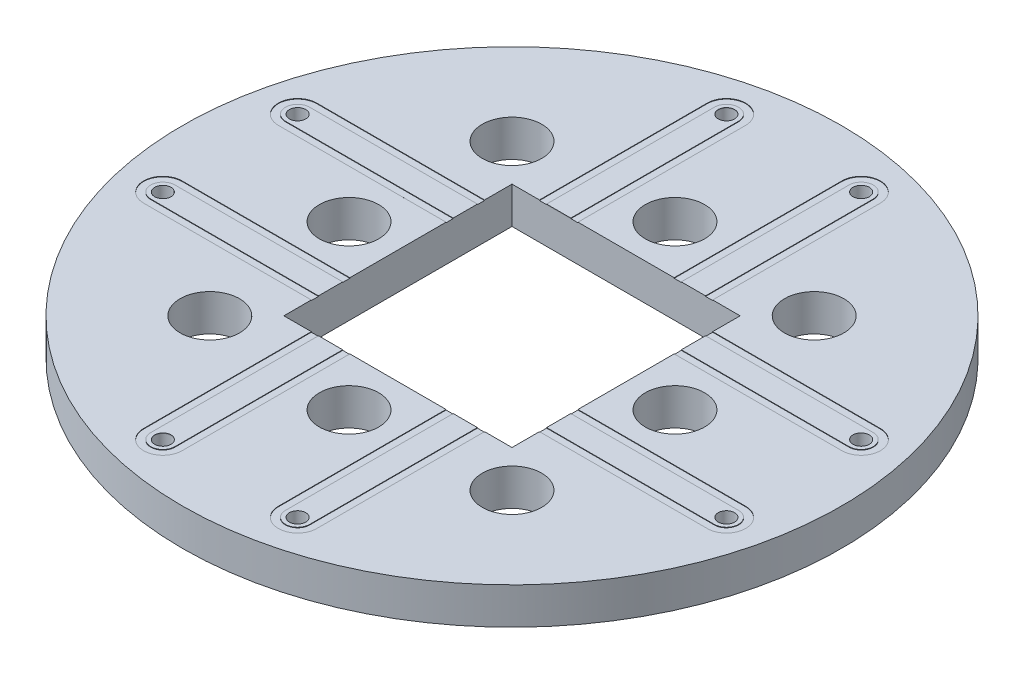
from build123d import *

# Parameters (mm, degrees)
BODY_SKETCH_R     = 11.557
BODY_DEPTH        = 1.27
COPPER_START      = 0.017500092
COPPER_SKETCH_R   = 11.557
COPPER_DEPTH      = 0.017500092
GAP_CUT_DEPTH     = 17.39333395
CENTER_DEPTH      = 0.017500092
IO_HOLE_SKETCH_R  = 0.287000061
IO_HOLE_DEPTH     = 17.39333395
GAP_CUTS_COUNT    = 4
CENTERS_COUNT     = 4
IO_HOLES_COUNT    = 4
POCKET_DEPTH      = 17.39333395
POCKET_DEPTH_BACK = 17.39333395
POCKET_SKETCH_W   = 8.000000002
POCKET_SKETCH_H   = 8.000000002
POSTS_R           = 1.0414
POST_CUT_DEPTH    = 17.39333395
POST_CUTS_COUNT   = 4


with BuildPart() as part:
    # Body Sketch → Body (new body)
    with BuildSketch(Plane(origin=(0, 0, 0), x_dir=(1, 0, 0), z_dir=(0, 1, 0))):
        Circle(BODY_SKETCH_R)
    extrude(amount=-BODY_DEPTH)

    # Copper Sketch → Copper (add)
    with BuildSketch(Plane(origin=(0, 0, 0), x_dir=(1, 0, 0), z_dir=(0, 1, 0)).offset(COPPER_START)):
        Circle(COPPER_SKETCH_R)
    extrude(amount=-COPPER_DEPTH)

    # Gap → Gap Cut (cut, through all)
    with BuildSketch(Plane(origin=(0, 0, 0), x_dir=(1, 0, 0), z_dir=(0, 1, 0))):
        with BuildLine():
            Line((-3.037200047, 9.881579386), (-3.037200047, -9.881579386))
            ThreePointArc((-3.037200047, -9.881579386), (-2.3622, -10.556579433), (-1.687199953, -9.881579386))
            Line((-1.687199953, -9.881579386), (-1.687199953, 9.881579386))
            ThreePointArc((-1.687199953, 9.881579386), (-2.3622, 10.556579433), (-3.037200047, 9.881579386))
        make_face()
    gap_cut = extrude(amount=GAP_CUT_DEPTH, mode=Mode.SUBTRACT)


with BuildPart() as body_2:
    # Center Sketch → Center (new body)
    with BuildSketch(Plane(origin=(0, 0, 0), x_dir=(1, 0, 0), z_dir=(0, 1, 0))):
        with BuildLine():
            Line((-2.787200039, 9.881579386), (-2.787200039, -9.881579386))
            ThreePointArc((-2.787200039, -9.881579386), (-2.3622, -10.306579425), (-1.937199961, -9.881579386))
            Line((-1.937199961, -9.881579386), (-1.937199961, 9.881579386))
            ThreePointArc((-1.937199961, 9.881579386), (-2.3622, 10.306579425), (-2.787200039, 9.881579386))
        make_face()
    center = extrude(amount=CENTER_DEPTH)


with BuildPart() as io_hole_tool:
    # IO Hole Sketch → IO Hole (new, symmetric)
    with BuildSketch(Plane(origin=(0, 0, 0), x_dir=(1, 0, 0), z_dir=(0, 1, 0))):
        with Locations((-2.3622, 9.881579386)):
            Circle(IO_HOLE_SKETCH_R)
        with Locations((-2.3622, -9.881579386)):
            Circle(IO_HOLE_SKETCH_R)
    io_hole = extrude(amount=IO_HOLE_DEPTH, both=True)


with BuildPart() as part_1:
    add(part.part)

    # IO Hole: cut by io_hole_tool
    add(io_hole_tool.part, mode=Mode.SUBTRACT)

    # Gap Cuts: Gap Cut ×4 about axis
    gap_cuts_axis = Axis((0, 0.0762, 0), (0, -1, 0))
    for i in range(1, GAP_CUTS_COUNT):
        add(gap_cut.rotate(gap_cuts_axis, i * 360 / GAP_CUTS_COUNT), mode=Mode.SUBTRACT)

    # Centers: Center ×4 about axis
    centers_axis = Axis((0, 0.0762, 0), (0, -1, 0))
    for i in range(1, CENTERS_COUNT):
        add(center.rotate(centers_axis, i * 360 / CENTERS_COUNT))

    # IO Holes: IO Hole ×4 about axis
    io_holes_axis = Axis((0, 0.0762, 0), (0, -1, 0))
    for i in range(1, IO_HOLES_COUNT):
        add(io_hole.rotate(io_holes_axis, i * 360 / IO_HOLES_COUNT), mode=Mode.SUBTRACT)


with BuildPart() as body_2_1:
    add(body_2.part)

    # IO Hole: cut by io_hole_tool
    add(io_hole_tool.part, mode=Mode.SUBTRACT)


with BuildPart() as pocket_tool:
    # Pocket Sketch → Pocket (new, two sides: drawn at the far end of the back side and taken through both)
    with BuildSketch(Plane(origin=(0, 0, 0), x_dir=(1, 0, 0), z_dir=(0, 1, 0)).offset(-POCKET_DEPTH_BACK)):
        Rectangle(POCKET_SKETCH_W, POCKET_SKETCH_H)
    extrude(amount=POCKET_DEPTH + POCKET_DEPTH_BACK)


with BuildPart() as part_2:
    add(part_1.part)

    # Pocket: cut by pocket_tool
    add(pocket_tool.part, mode=Mode.SUBTRACT)

    # Posts → Post Cut (cut, symmetric)
    with BuildSketch(Plane(origin=(0, 0, 0), x_dir=(1, 0, 0), z_dir=(0, 1, 0))):
        with Locations((0, 5.715)):
            Circle(POSTS_R)
        with Locations((-5.298351111, 5.298351111)):
            Circle(POSTS_R)
    post_cut = extrude(amount=POST_CUT_DEPTH, both=True, mode=Mode.SUBTRACT)

    # Post Cuts: Post Cut ×4 about axis
    post_cuts_axis = Axis((0, 0.0762, 0), (0, -1, 0))
    for i in range(1, POST_CUTS_COUNT):
        add(post_cut.rotate(post_cuts_axis, i * 360 / POST_CUTS_COUNT), mode=Mode.SUBTRACT)


with BuildPart() as body_2_2:
    add(body_2_1.part)

    # Pocket: cut by pocket_tool
    add(pocket_tool.part, mode=Mode.SUBTRACT)


solid = Compound([part_2.part, body_2_2.part])
